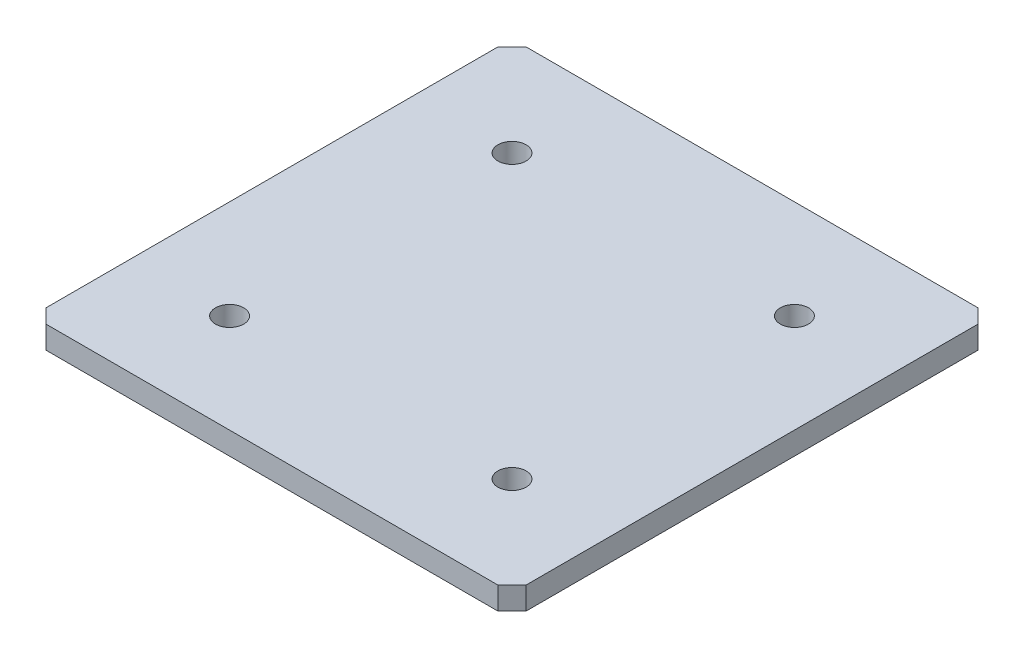
from build123d import *

# Parameters (mm, degrees)
SKETCH1_W           = 170
SKETCH1_H           = 170
BOSS_EXTRUDE1_DEPTH = 8
CUT_EXTRUDE2_REACH  = 122.474
SKETCH3_R           = 5
CHAMFER1_SIZE       = 5


with BuildPart() as part:
    # Sketch1 → Boss-Extrude1 (new body)
    with BuildSketch(Plane(origin=(0, 0, 0), x_dir=(1, 0, 0), z_dir=(0, 1, 0))):
        Rectangle(SKETCH1_W, SKETCH1_H)
    extrude(amount=BOSS_EXTRUDE1_DEPTH)

    # Sketch3 → Cut-Extrude2 (cut, up to next)
    with BuildSketch(Plane(origin=(0, 8, 0), x_dir=(1, 0, 0), z_dir=(0, 1, 0)), mode=Mode.PRIVATE) as cut_extrude2_sk1:
        with Locations((-50, 50)):
            Circle(SKETCH3_R)
    cut_extrude2_tool1 = extrude(cut_extrude2_sk1.sketch, amount=-CUT_EXTRUDE2_REACH, mode=Mode.PRIVATE) & part.part
    # Sketch3 → Cut-Extrude2 (cut, up to next)
    with BuildSketch(Plane(origin=(0, 8, 0), x_dir=(1, 0, 0), z_dir=(0, 1, 0)), mode=Mode.PRIVATE) as cut_extrude2_sk2:
        with Locations((50, 50)):
            Circle(SKETCH3_R)
    cut_extrude2_tool2 = extrude(cut_extrude2_sk2.sketch, amount=-CUT_EXTRUDE2_REACH, mode=Mode.PRIVATE) & part.part
    # Sketch3 → Cut-Extrude2 (cut, up to next)
    with BuildSketch(Plane(origin=(0, 8, 0), x_dir=(1, 0, 0), z_dir=(0, 1, 0)), mode=Mode.PRIVATE) as cut_extrude2_sk3:
        with Locations((-50, -50)):
            Circle(SKETCH3_R)
    cut_extrude2_tool3 = extrude(cut_extrude2_sk3.sketch, amount=-CUT_EXTRUDE2_REACH, mode=Mode.PRIVATE) & part.part
    # Sketch3 → Cut-Extrude2 (cut, up to next)
    with BuildSketch(Plane(origin=(0, 8, 0), x_dir=(1, 0, 0), z_dir=(0, 1, 0)), mode=Mode.PRIVATE) as cut_extrude2_sk4:
        with Locations((50, -50)):
            Circle(SKETCH3_R)
    cut_extrude2_tool4 = extrude(cut_extrude2_sk4.sketch, amount=-CUT_EXTRUDE2_REACH, mode=Mode.PRIVATE) & part.part
    add(cut_extrude2_tool1.solids().sort_by_distance((-50, 8, -50))[0], mode=Mode.SUBTRACT)
    add(cut_extrude2_tool2.solids().sort_by_distance((50, 8, -50))[0], mode=Mode.SUBTRACT)
    add(cut_extrude2_tool3.solids().sort_by_distance((-50, 8, 50))[0], mode=Mode.SUBTRACT)
    add(cut_extrude2_tool4.solids().sort_by_distance((50, 8, 50))[0], mode=Mode.SUBTRACT)

    # Chamfer1
    chamfer1_edges = [part.edges().sort_by_distance(p)[0] for p in [
        (-85, 4, -85),
        (85, 4, -85),
        (85, 4, 85),
        (-85, 4, 85),
    ]]
    chamfer(chamfer1_edges, length=CHAMFER1_SIZE)


solid = part.part
